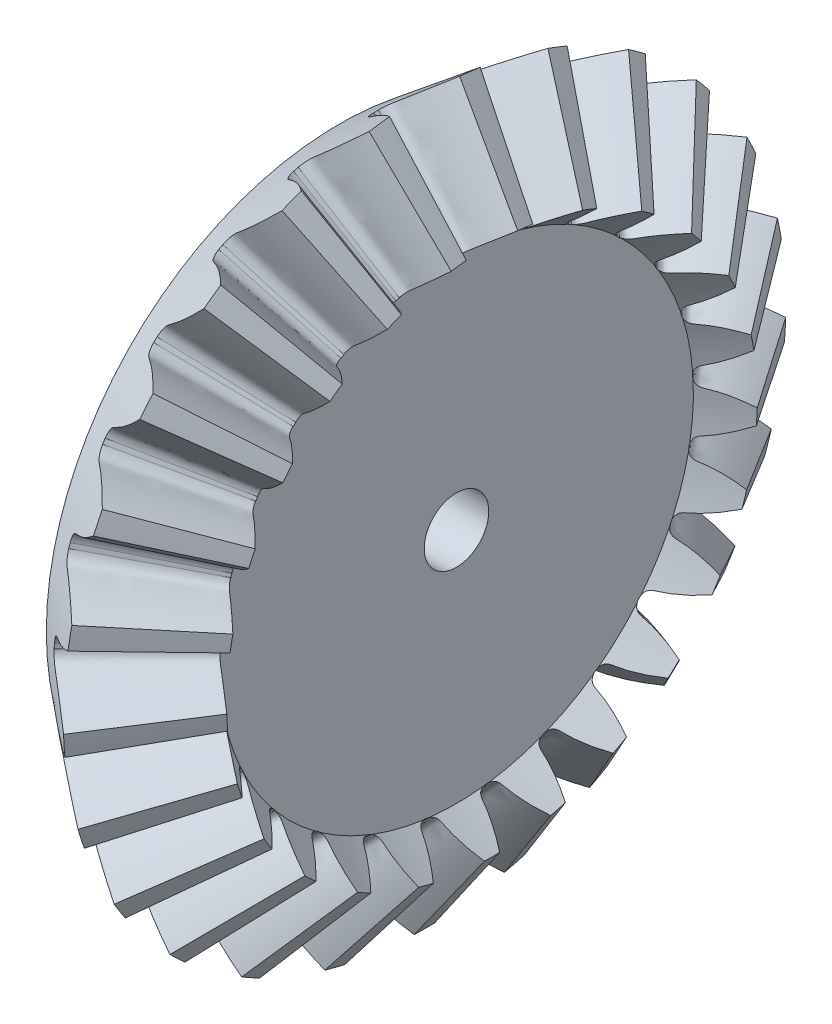
from build123d import *

# Parameters (mm, degrees)
PATTERN_CIRCULAR_1_COUNT = 25


# Read off the part's stored shape, not the designer's step: 旋转1
with BuildPart() as part:
    # 旋转1 outline → 旋转1 (revolve)
    with BuildSketch(Plane.YX):
        Polygon((2.343826238, 26.609459347), (21.287567478, 26.609459347), (26.249390095, 32.811737619), (19.280297898, 37.707011377), (17.215511647, 35.126028564), (2.343826238, 35.126028564), align=None)
    revolve(axis=Axis((0, 0, 0), (1, 0, 0)))

    # 草图6 → 切除-放样1 section 0
    with BuildSketch(Plane(origin=(0, 0, 0), x_dir=(0, 0, -1), z_dir=(0.6246950475544241, -0.7808688094430305, -1.034115535551072e-13)), mode=Mode.PRIVATE) as loft_1_s0:
        with BuildLine():
            ThreePointArc((0.16918176, 37.499618365), (0, 37.5), (-0.16918176, 37.499618365))
            add(Edge.make_bspline(
                [(-0.16918176, 37.499618365), (-0.911330078, 37.608098193), (-0.978980826, 38.140970951), (-1.133943369, 38.712387634), (-1.187845771, 38.898530883), (-1.250079132, 39.0978385), (-1.321002455, 39.310146689), (-1.401214654, 39.53515181), (-1.491233335, 39.772570509), (-1.591589846, 40.022092299), (-1.702800608, 40.283393849), (-1.825374986, 40.556135064), (-1.959812431, 40.839960528), (-2.106602773, 41.134499387), (-2.2662256, 41.439365707), (-2.439149912, 41.754158704), (-2.625833701, 42.078463026), (-2.826723561, 42.411849031), (-3.042254304, 42.75387308), (-3.272848576, 43.104077836), (-3.518916486, 43.461992582), (-3.780855241, 43.827133533), (-4.05904879, 44.199004173), (-4.353867471, 44.577095587), (-4.665667675, 44.960886815), (-4.994791513, 45.349845205), (-5.341566483, 45.743426777), (-5.706305194, 46.141076597), (-6.089304912, 46.542229163), (-6.631761091, 47.08811222), (-7.056376945, 47.490208929), (-7.348266686, 47.756027158)],
                knots=[0, 0, 0, 0, 0.110656833, 0.124738805, 0.140005423, 0.156456686, 0.174092594, 0.192913148, 0.212918347, 0.234108191, 0.25648268, 0.280041814, 0.304785594, 0.330714019, 0.357827089, 0.386124804, 0.415607165, 0.446274171, 0.478125822, 0.511162118, 0.545383059, 0.580788646, 0.617378878, 0.655153755, 0.694113277, 0.734257445, 0.775586258, 0.818099716, 0.861797819, 0.906680567, 1, 1, 1, 1], degree=3))
            ThreePointArc((-7.348266686, 47.756027158), (0, 48.318062391), (7.348266686, 47.756027158))
            add(Edge.make_bspline(
                [(0.16918176, 37.499618365), (0.911330078, 37.608098193), (0.978980826, 38.140970951), (1.133943369, 38.712387634), (1.187845771, 38.898530883), (1.250079132, 39.0978385), (1.321002455, 39.310146689), (1.401214654, 39.53515181), (1.491233335, 39.772570509), (1.591589846, 40.022092299), (1.702800608, 40.283393849), (1.825374986, 40.556135064), (1.959812431, 40.839960528), (2.106602773, 41.134499387), (2.2662256, 41.439365707), (2.439149912, 41.754158704), (2.625833701, 42.078463026), (2.826723561, 42.411849031), (3.042254304, 42.75387308), (3.272848576, 43.104077836), (3.518916486, 43.461992582), (3.780855241, 43.827133533), (4.05904879, 44.199004173), (4.353867471, 44.577095587), (4.665667675, 44.960886815), (4.994791513, 45.349845205), (5.341566483, 45.743426777), (5.706305194, 46.141076597), (6.089304912, 46.542229163), (6.631761091, 47.08811222), (7.056376945, 47.490208929), (7.348266686, 47.756027158)],
                knots=[0, 0, 0, 0, 0.110656833, 0.124738805, 0.140005423, 0.156456686, 0.174092594, 0.192913148, 0.212918347, 0.234108191, 0.25648268, 0.280041814, 0.304785594, 0.330714019, 0.357827089, 0.386124804, 0.415607165, 0.446274171, 0.478125822, 0.511162118, 0.545383059, 0.580788646, 0.617378878, 0.655153755, 0.694113277, 0.734257445, 0.775586258, 0.818099716, 0.861797819, 0.906680567, 1, 1, 1, 1], degree=3))
        make_face()
    loft_1 = loft([loft_1_s0.sketch, Vertex(51.25, 0, 0)], mode=Mode.SUBTRACT)

    # 阵列(圆周)1: 切除-放样1 ×25 about axis
    pattern_circular_1_axis = Axis((44.300117179, 0, 0), (-1, 0, 0))
    for i in range(1, PATTERN_CIRCULAR_1_COUNT):
        add(loft_1.rotate(pattern_circular_1_axis, i * 360 / PATTERN_CIRCULAR_1_COUNT), mode=Mode.SUBTRACT)


solid = part.part
